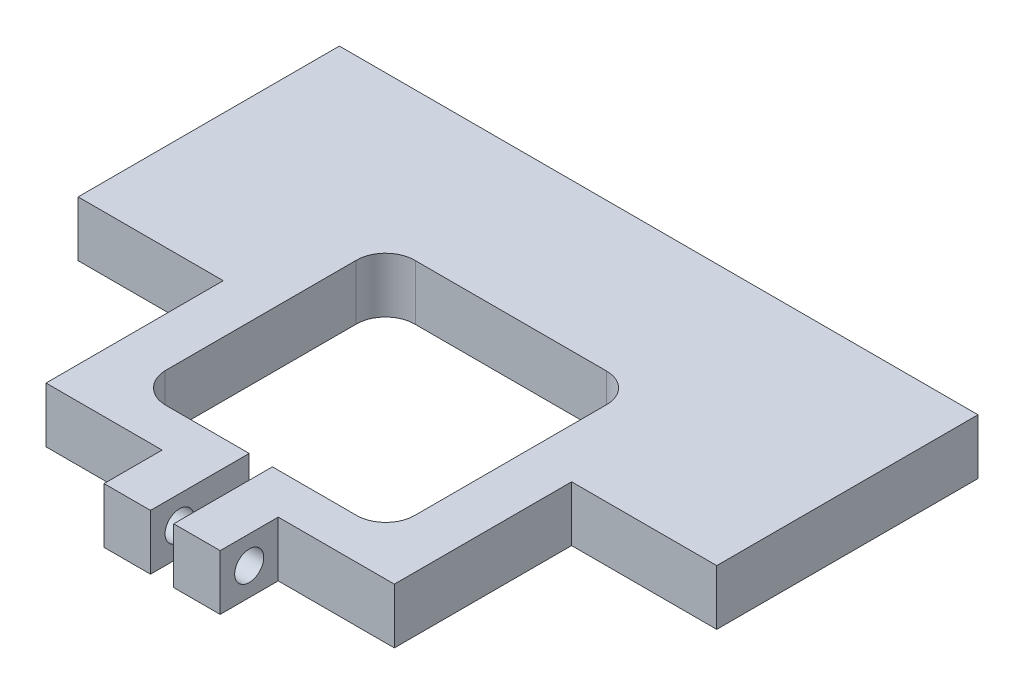
from build123d import *

# Parameters (mm, degrees)
ESBO_O1_W                    = 60
ESBO_O1_H                    = 50
RESSALTO_EXTRUS_O1_DEPTH     = 9.52
CORTE_EXTRUS_O1_DEPTH        = 9.52
CORTE_EXTRUS_O1_START        = 7.26
CORTE_EXTRUS_O1_2_DEPTH      = 2.26
CORTE_EXTRUS_O1_3_DEPTH      = 2.2599999
CORTE_EXTRUS_O1_START_2      = -30
CORTE_EXTRUS_O1_4_OUTLINE_W  = 5.0000001
CORTE_EXTRUS_O1_4_OUTLINE_H  = 3.572491942
CORTE_EXTRUS_O1_4_DEPTH      = 28
CORTE_EXTRUS_O1_START_3      = 2
CORTE_EXTRUS_O1_5_OUTLINE_W  = 5.0000001
CORTE_EXTRUS_O1_5_OUTLINE_H  = 3.572491942
CORTE_EXTRUS_O1_5_DEPTH      = 28
CORTE_EXTRUS_O1_START_4      = -10
CORTE_EXTRUS_O1_6_DEPTH      = 8
CORTE_EXTRUS_O1_7_DEPTH      = 8
CORTE_EXTRUS_O1_START_5      = -46.96
CORTE_EXTRUS_O1_8_DEPTH      = 21.96
CORTE_EXTRUS_O1_START_6      = -26.96
CORTE_EXTRUS_O1_9_OUTLINE_W  = 25
CORTE_EXTRUS_O1_9_OUTLINE_H  = 5.0000001
CORTE_EXTRUS_O1_9_DEPTH      = 25
CORTE_EXTRUS_O1_10_OUTLINE_R = 2.5
CORTE_EXTRUS_O1_10_DEPTH     = 1.96


with BuildPart() as part:
    # Esboço1 → Ressalto-extrusão1 (new body)
    with BuildSketch(Plane(origin=(0, 0, 0), x_dir=(1, 0, 0), z_dir=(0, 1, 0))):
        Rectangle(ESBO_O1_W, ESBO_O1_H)
    extrude(amount=RESSALTO_EXTRUS_O1_DEPTH)

    # Corte-extrusão1: read off the stored shape, not the designer's step
    # Corte-extrusão1 outline → Corte-extrusão1 (cut)
    with BuildSketch(Plane(origin=(0, 0, 0), x_dir=(1, 0, 0), z_dir=(0, 1, 0))):
        with BuildLine():
            ThreePointArc((-16.551848481, -21.569831255), (-16.522584074, -21.571242343), (-16.493312326, -21.572491942))
            Line((-16.493312326, -21.572491942), (-2, -21.572491942))
            Line((-2, -21.572491942), (-2, -25))
            Line((-2, -25), (2, -25))
            Line((2, -25), (2, -21.572491942))
            Line((2, -21.572491942), (16.511245971, -21.572491942))
            ThreePointArc((16.511245971, -21.572491942), (20.046779877, -20.108025848), (21.511245971, -16.572491942))
            Line((21.511245971, -16.572491942), (21.511245971, 16.45))
            ThreePointArc((21.511245971, 16.45), (20.037938418, 20.019740143), (16.469538401, 21.496290566))
            Line((16.469538401, 21.496290566), (-16.430461599, 21.496290566))
            ThreePointArc((-16.430461599, 21.496290566), (-20.093320705, 20.064258273), (-21.587468917, 16.426295322))
            Line((-21.587468917, 16.426295322), (-21.587468917, -16.473704678))
            ThreePointArc((-21.587468917, -16.473704678), (-20.959260779, -18.779602466), (-19.383464148, -20.576453893))
            ThreePointArc((-19.383464148, -20.576453893), (-18.043937425, -21.290581379), (-16.551848481, -21.569831255))
        make_face()
    extrude(amount=CORTE_EXTRUS_O1_DEPTH, mode=Mode.SUBTRACT)

    # Corte-extrus_o1 2 outline → Corte-extrus_o1 2 (add)
    with BuildSketch(Plane(origin=(0, 0, 0), x_dir=(1, 0, 0), z_dir=(0, 1, 0)).offset(CORTE_EXTRUS_O1_START)):
        Polygon((-2, -38.572491942), (-2, -25), (-30, -25), (-30, -28.572491942), (-10, -28.572491942), (-10, -38.572491942), align=None)
        Polygon((30, -25), (2, -25), (2, -38.572491942), (10, -38.572491942), (10, -28.572491942), (30, -28.572491942), align=None)
        Polygon((-55, 1.96), (-30, 1.96), (-30, 25), (30, 25), (30, 1.96), (55, 1.96), (55, 46.96), (-55, 46.96), align=None)
    extrude(amount=CORTE_EXTRUS_O1_2_DEPTH)

    # Corte-extrus_o1 3 outline → Corte-extrus_o1 3 (add)
    with BuildSketch(Plane(origin=(0, 0, 0), x_dir=(1, 0, 0), z_dir=(0, 1, 0))):
        Polygon((-2, -38.572491942), (-2, -25), (-30, -25), (-30, -28.572491942), (-10, -28.572491942), (-10, -38.572491942), align=None)
        Polygon((30, -25), (2, -25), (2, -38.572491942), (10, -38.572491942), (10, -28.572491942), (30, -28.572491942), align=None)
        Polygon((-55, 1.96), (-30, 1.96), (-30, 25), (30, 25), (30, 1.96), (55, 1.96), (55, 46.96), (-55, 46.96), align=None)
    extrude(amount=CORTE_EXTRUS_O1_3_DEPTH)

    # Corte-extrus_o1 4 outline → Corte-extrus_o1 4 (add)
    with BuildSketch(Plane.YZ.offset(CORTE_EXTRUS_O1_START_2)):
        with Locations((4.75999995, 26.786245971)):
            Rectangle(CORTE_EXTRUS_O1_4_OUTLINE_W, CORTE_EXTRUS_O1_4_OUTLINE_H)
    extrude(amount=CORTE_EXTRUS_O1_4_DEPTH)

    # Corte-extrus_o1 5 outline → Corte-extrus_o1 5 (add)
    with BuildSketch(Plane.YZ.offset(CORTE_EXTRUS_O1_START_3)):
        with Locations((4.75999995, 26.786245971)):
            Rectangle(CORTE_EXTRUS_O1_5_OUTLINE_W, CORTE_EXTRUS_O1_5_OUTLINE_H)
    extrude(amount=CORTE_EXTRUS_O1_5_DEPTH)

    # Corte-extrus_o1 6 outline → Corte-extrus_o1 6 (add)
    with BuildSketch(Plane.YZ.offset(CORTE_EXTRUS_O1_START_4)):
        with BuildLine():
            Line((7.26, 28.572491942), (7.26, 33.572491942))
            ThreePointArc((7.26, 33.572491942), (4.76, 31.072491942), (2.26, 33.572491942))
            Line((2.26, 33.572491942), (2.2599999, 28.572491942))
            Line((2.2599999, 28.572491942), (7.26, 28.572491942))
        make_face()
        with BuildLine():
            ThreePointArc((2.26, 33.572491942), (4.76, 36.072491942), (7.26, 33.572491942))
            Line((7.26, 33.572491942), (7.26, 38.572491942))
            Line((7.26, 38.572491942), (2.2599999, 38.572491942))
            Line((2.2599999, 38.572491942), (2.26, 33.572491942))
        make_face()
    extrude(amount=CORTE_EXTRUS_O1_6_DEPTH)

    # Corte-extrus_o1 7 outline → Corte-extrus_o1 7 (add)
    with BuildSketch(Plane.YZ.offset(CORTE_EXTRUS_O1_START_3)):
        with BuildLine():
            Line((7.26, 28.572491942), (7.26, 33.572491942))
            ThreePointArc((7.26, 33.572491942), (4.76, 31.072491942), (2.26, 33.572491942))
            Line((2.26, 33.572491942), (2.2599999, 28.572491942))
            Line((2.2599999, 28.572491942), (7.26, 28.572491942))
        make_face()
        with BuildLine():
            ThreePointArc((2.26, 33.572491942), (4.76, 36.072491942), (7.26, 33.572491942))
            Line((7.26, 33.572491942), (7.26, 38.572491942))
            Line((7.26, 38.572491942), (2.2599999, 38.572491942))
            Line((2.2599999, 38.572491942), (2.26, 33.572491942))
        make_face()
    extrude(amount=CORTE_EXTRUS_O1_7_DEPTH)

    # Corte-extrus_o1 8 outline → Corte-extrus_o1 8 (add)
    with BuildSketch(Plane.XY.offset(CORTE_EXTRUS_O1_START_5)):
        with BuildLine():
            ThreePointArc((45, 7.26), (47.5, 4.76), (45, 2.26))
            Line((45, 2.26), (55, 2.2599999))
            Line((55, 2.2599999), (55, 7.26))
            Line((55, 7.26), (45, 7.26))
        make_face()
        with BuildLine():
            ThreePointArc((45, 2.26), (42.5, 4.76), (45, 7.26))
            Line((45, 7.26), (15.000000025, 7.26))
            ThreePointArc((15.000000025, 7.26), (17.5, 4.759999988), (15.000000001, 2.26))
            Line((15.000000001, 2.26), (45, 2.26))
        make_face()
        with BuildLine():
            ThreePointArc((15.000000001, 2.26), (12.5, 4.760000012), (15.000000025, 7.26))
            Line((15.000000025, 7.26), (-15.000000034, 7.26))
            ThreePointArc((-15.000000034, 7.26), (-12.5, 4.760000017), (-15, 2.26))
            Line((-15, 2.26), (15.000000001, 2.26))
        make_face()
        with BuildLine():
            ThreePointArc((-15, 2.26), (-17.5, 4.759999983), (-15.000000034, 7.26))
            Line((-15.000000034, 7.26), (-44.999999984, 7.26))
            ThreePointArc((-44.999999984, 7.26), (-42.5, 4.759999992), (-45, 2.26))
            Line((-45, 2.26), (-15, 2.26))
        make_face()
        with BuildLine():
            ThreePointArc((-45, 2.26), (-47.5, 4.760000008), (-44.999999984, 7.26))
            Line((-44.999999984, 7.26), (-55, 7.26))
            Line((-55, 7.26), (-55, 2.2599999))
            Line((-55, 2.2599999), (-45, 2.26))
        make_face()
    extrude(amount=CORTE_EXTRUS_O1_8_DEPTH)

    # Corte-extrus_o1 9 outline → Corte-extrus_o1 9 (add)
    with BuildSketch(Plane.XY.offset(CORTE_EXTRUS_O1_START_6)):
        with Locations((42.5, 4.75999995)):
            Rectangle(CORTE_EXTRUS_O1_9_OUTLINE_W, CORTE_EXTRUS_O1_9_OUTLINE_H)
        with Locations((-42.5, 4.75999995)):
            Rectangle(CORTE_EXTRUS_O1_9_OUTLINE_W, CORTE_EXTRUS_O1_9_OUTLINE_H)
    extrude(amount=CORTE_EXTRUS_O1_9_DEPTH)

    # Corte-extrus_o1 10 outline → Corte-extrus_o1 10 (add)
    with BuildSketch(Plane.XY.offset(CORTE_EXTRUS_O1_START_6)):
        with Locations((15, 4.76)):
            Circle(CORTE_EXTRUS_O1_10_OUTLINE_R)
        with Locations((-15, 4.76)):
            Circle(CORTE_EXTRUS_O1_10_OUTLINE_R)
    extrude(amount=CORTE_EXTRUS_O1_10_DEPTH)


solid = part.part
